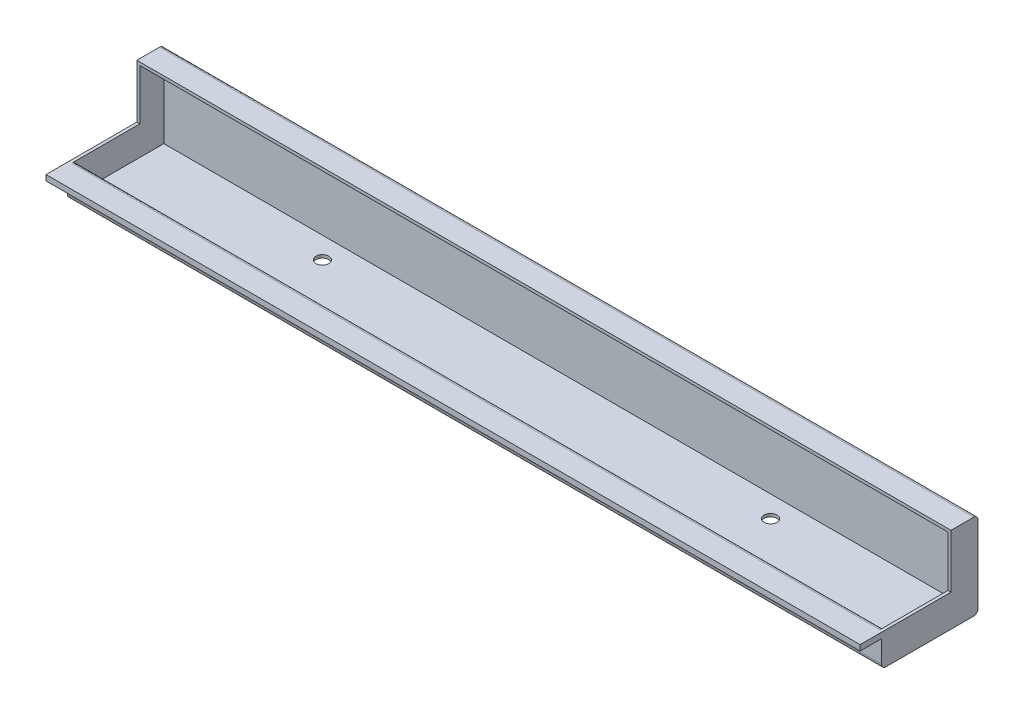
from build123d import *

# Parameters (mm, degrees)
SKETCH1_W           = 482.6
SKETCH1_H           = 50.8
BOSS_EXTRUDE1_DEPTH = 69.85
CUT_EXTRUDE2_DEPTH  = 49.022
SKETCH3_W           = 482.6
SKETCH3_H           = 16.002
CUT_EXTRUDE3_DEPTH  = 31.75
SKETCH4_W           = 482.6
SKETCH4_H           = 15.748
CUT_EXTRUDE4_DEPTH  = 12.7
SHELL2_START        = -23.622
SHELL2_OUTLINE_W    = 479.044
SHELL2_OUTLINE_H    = 14.224
SHELL2_DEPTH        = 47.244
SKETCH5_W           = 1.778
SKETCH5_H           = 17.272
BOSS_EXTRUDE2_DEPTH = 44.45
FILLET1_R           = 2.54
SKETCH6_R           = 3.81
CUT_EXTRUDE5_DEPTH  = 44.45


# Read off the part's stored shape, not the designer's step: Shell2
with BuildPart() as part:
    # Sketch1 → Boss-Extrude1 (new body)
    with BuildSketch(Plane.XY):
        Rectangle(SKETCH1_W, SKETCH1_H)
    extrude(amount=BOSS_EXTRUDE1_DEPTH)

    # Sketch2 → Cut-Extrude2 (cut)
    with BuildSketch(Plane(origin=(0, 25.4, 0), x_dir=(1, 0, 0), z_dir=(0, 1, 0))):
        Polygon((241.3, -16.002), (-241.3, -16.002), (-241.3, -34.925), (-241.3, -53.848), (241.3, -53.848), align=None)
    extrude(amount=-CUT_EXTRUDE2_DEPTH, mode=Mode.SUBTRACT)

    # Sketch3 → Cut-Extrude3 (cut)
    with BuildSketch(Plane(origin=(0, 25.4, 0), x_dir=(1, 0, 0), z_dir=(0, 1, 0))):
        with Locations((0, -61.849)):
            Rectangle(SKETCH3_W, SKETCH3_H)
    extrude(amount=-CUT_EXTRUDE3_DEPTH, mode=Mode.SUBTRACT)

    # Sketch4 → Cut-Extrude4 (cut)
    with BuildSketch(Plane.XY.offset(69.85)):
        with Locations((0, -17.526)):
            Rectangle(SKETCH4_W, SKETCH4_H)
    extrude(amount=-CUT_EXTRUDE4_DEPTH, mode=Mode.SUBTRACT)

    # Shell2 outline → Shell2 (cut)
    with BuildSketch(Plane(origin=(0, 0, 0), x_dir=(1, 0, 0), z_dir=(0, 1, 0)).offset(SHELL2_START)):
        with Locations((0, -8.89)):
            Rectangle(SHELL2_OUTLINE_W, SHELL2_OUTLINE_H)
    extrude(amount=SHELL2_DEPTH, mode=Mode.SUBTRACT)

    # Sketch5 → Boss-Extrude2 (add)
    with BuildSketch(Plane(origin=(0, 0, 53.848), x_dir=(-1, 0, 0), z_dir=(0, 0, -1))):
        with Locations((240.411, -14.986)):
            Rectangle(SKETCH5_W, SKETCH5_H)
        with Locations((-240.411, -14.986)):
            Rectangle(SKETCH5_W, SKETCH5_H)
    extrude(amount=BOSS_EXTRUDE2_DEPTH)

    # Fillet1
    fillet1_edges = [part.edges().sort_by_distance(p)[0] for p in [
        (0, -25.4, 0),
        (0, -25.4, 57.15),
        (0, 25.4, 0),
        (0, -6.35, 53.848),
    ]]
    fillet(fillet1_edges, radius=FILLET1_R)

    # Sketch6 → Cut-Extrude5 (cut)
    with BuildSketch(Plane(origin=(0, -23.622, 0), x_dir=(1, 0, 0), z_dir=(0, 1, 0))):
        with Locations(Location((-132.842, -14.478, 0), (0, 0, 270))):
            Circle(SKETCH6_R)
        with Locations(Location((132.842, -14.478, 0), (0, 0, 270))):
            Circle(SKETCH6_R)
    extrude(amount=-CUT_EXTRUDE5_DEPTH, mode=Mode.SUBTRACT)


solid = part.part
